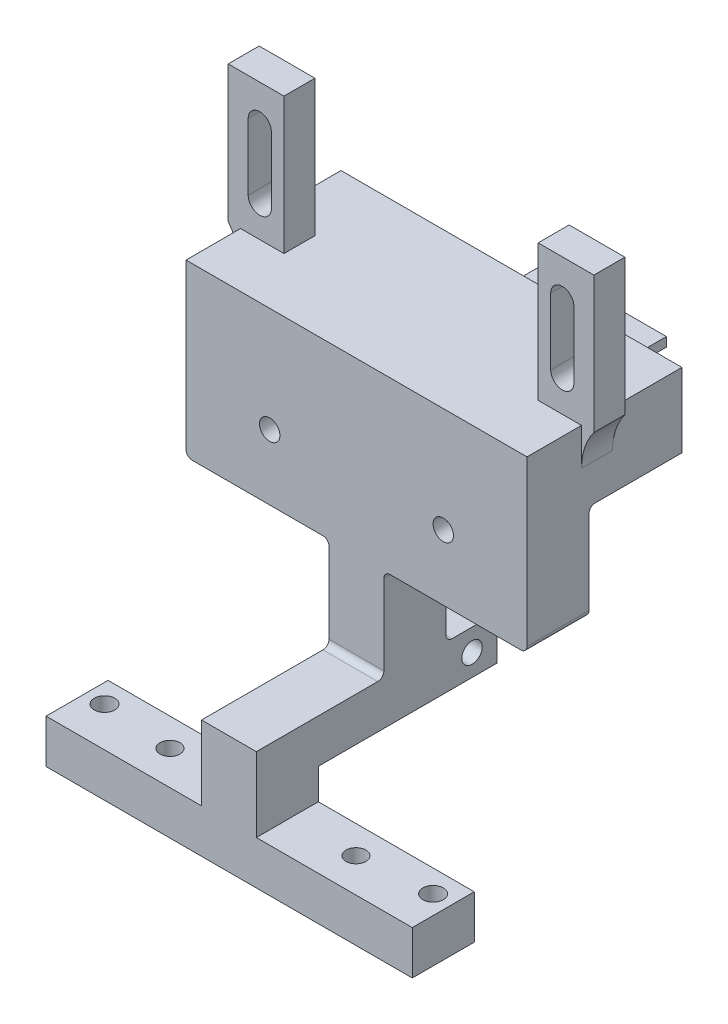
from build123d import *

# Parameters (mm, degrees)
SKETCH_1_W                   = 35
SKETCH_1_H                   = 40
EXTRUDE_1_DEPTH              = 5
SKETCH_2_W                   = 20
SKETCH_2_H                   = 20
EXTRUDE_2_DEPTH              = 65
SKETCH_3_W                   = 56
SKETCH_3_H                   = 11
SKETCH_3_W_2                 = 4.5
CUT_EXTRUDE_1_DEPTH          = 78.821912081
SKETCH_5_W                   = 55
SKETCH_5_H                   = 20
EXTRUDE_3_DEPTH              = 25
SKETCH_9_R                   = 1.65
CUT_EXTRUDE_3_DEPTH          = 27
SKETCH_10_W                  = 55
SKETCH_10_H                  = 25
EXTRUDE_4_DEPTH              = 4.9
SKETCH_11_W                  = 7
SKETCH_11_H                  = 5
EXTRUDE_5_DEPTH              = 21
CHAMFER_2_SIZE               = 10
CHAMFER_3_SIZE               = 3
CHAMFER_4_SIZE               = 2
CUT_EXTRUDE_7_DEPTH          = 15
SKETCH_16_W                  = 12.984556049
SKETCH_16_H                  = 11
EXTRUDE_6_DEPTH              = 20
CHAMFER_5_SIZE               = 3
SKETCH_19_R                  = 1.6
CUT_EXTRUDE_10_DEPTH         = 10
FILLET_1_R                   = 5
SKETCH_20_W                  = 5
SKETCH_20_H                  = 22.5
EXTRUDE_7_DEPTH              = 17.5
SKETCH_21_W                  = 5
SKETCH_21_H                  = 22.5
EXTRUDE_8_DEPTH              = 5
SKETCH_22_W                  = 5
SKETCH_22_H                  = 22.5
EXTRUDE_9_DEPTH              = 10
SKETCH_23_W                  = 5
SKETCH_23_H                  = 22.5
EXTRUDE_10_DEPTH             = 10
SKETCH_24_W                  = 3.3
SKETCH_24_H                  = 22.5
EXTRUDE_11_DEPTH             = 4
SKETCH_26_W                  = 5
SKETCH_26_H                  = 22.5
EXTRUDE_13_DEPTH             = 17.5
SKETCH_27_W                  = 5
SKETCH_27_H                  = 22.5
EXTRUDE_14_DEPTH             = 5
SKETCH_28_W                  = 5
SKETCH_28_H                  = 22.5
EXTRUDE_15_DEPTH             = 10
SKETCH_29_W                  = 5
SKETCH_29_H                  = 22.5
EXTRUDE_16_DEPTH             = 10
SKETCH_31_W                  = 3.4
SKETCH_31_H                  = 22.5
EXTRUDE_18_DEPTH             = 4
SKETCH_39_W                  = 7.13678645
SKETCH_39_H                  = 13.518332953
SKETCH_39_W_2                = 8.139264071
SKETCH_39_H_2                = 10.52230198
CUT_EXTRUDE_17_DEPTH         = 35
SKETCH_40_W                  = 55
SKETCH_40_H                  = 10
EXTRUDE_20_DEPTH             = 25.575713879
SKETCH_41_W                  = 8.84873954
SKETCH_41_H                  = 7.046133319
EXTRUDE_21_DEPTH             = 20.577981656
EXTRUDE_22_DEPTH             = 13.07563
EXTRUDE_22_DEPTH_BACK        = 22
SKETCH_42_W                  = 38.79276714
SKETCH_42_H                  = 7.046133319
SKETCH_43_W                  = 23.07563023
SKETCH_43_H                  = 28.79276714
CUT_EXTRUDE_18_DEPTH         = 22
FILLET_3_R                   = 1
SKETCH_46_W                  = 9.238205764
SKETCH_46_H                  = 22.5
EXTRUDE_26_DEPTH             = 10
CUT_EXTRUDE_19_DEPTH         = 10
SKETCH_48_R                  = 1.6
CUT_EXTRUDE_20_DEPTH         = 10
CUT_EXTRUDE_21_DEPTH         = 10
SKETCH_50_W                  = 2.57104036
SKETCH_50_H                  = 22.5
SKETCH_50_W_2                = 2.865096637
EXTRUDE_27_DEPTH             = 10
SKETCH_53_W                  = 4.304606657
SKETCH_53_H                  = 10
SKETCH_53_W_2                = 2.865096637
EXTRUDE_28_DEPTH             = 11
SKETCH_51_R                  = 1.6
CUT_EXTRUDE_22_DEPTH         = 12
SKETCH_52_W                  = 17.2
SKETCH_52_H                  = 6.8
CUT_EXTRUDE_23_DEPTH         = 39
CUT_EXTRUDE_24_DEPTH         = 10
SKETCH_55_W                  = 32
SKETCH_55_H                  = 22.5
EXTRUDE_29_DEPTH             = 12
SKETCH_56_W                  = 10.301119562
SKETCH_56_H                  = 22.5
CUT_EXTRUDE_25_DEPTH         = 7
SKETCH_57_W                  = 3
SKETCH_57_H                  = 4.95
EXTRUDE_30_DEPTH             = 8
SKETCH_58_W                  = 9
SKETCH_58_H                  = 22.5
SKETCH_58_W_2                = 8.434386946
CUT_EXTRUDE_26_DEPTH         = 10.05
CUT_EXTRUDE_27_DEPTH         = 1
SKETCH_60_W                  = 2.55
SKETCH_60_H                  = 22.5
EXTRUDE_31_DEPTH             = 12
SKETCH_61_W                  = 3.965384327
SKETCH_61_H                  = 22.5
CUT_EXTRUDE_28_DEPTH         = 6.95
SKETCH_62_W                  = 5
SKETCH_62_H                  = 22
EXTRUDE_32_DEPTH             = 2
SKETCH_63_W                  = 5
SKETCH_63_H                  = 22
EXTRUDE_33_DEPTH             = 2
SKETCH_64_W                  = 5
SKETCH_64_H                  = 22.5
EXTRUDE_34_DEPTH             = 8
SKETCH_65_W                  = 0.1
SKETCH_65_H                  = 22.5
CUT_EXTRUDE_30_DEPTH         = 15
SKETCH_66_W                  = 5
SKETCH_66_H                  = 22.5
EXTRUDE_35_DEPTH             = 8
SKETCH_67_R                  = 1.1
CUT_EXTRUDE_31_DEPTH         = 9
SKETCH_68_W                  = 0.1
SKETCH_68_H                  = 22.5
CUT_EXTRUDE_32_DEPTH         = 12
SKETCH_69_W                  = 12
SKETCH_69_H                  = 22.5
EXTRUDE_36_DEPTH             = 5
SKETCH_70_W                  = 107.728068616
SKETCH_70_H                  = 75.066227262
CUT_EXTRUDE_33_DEPTH         = 130
SKETCH_73_W                  = 6.7
SKETCH_73_H                  = 9
CUT_EXTRUDE_34_DEPTH         = 19
FILLET_5_R                   = 10
SKETCH_75_W                  = 20
SKETCH_75_H                  = 11.957252994
SKETCH_75_W_2                = 6.7
SKETCH_75_H_2                = 9
EXTRUDE_38_DEPTH             = 15
CUT_EXTRUDE_35_DEPTH         = 20
SKETCH_76_W                  = 3.65
SKETCH_76_H                  = 9
CUT_EXTRUDE_36_DEPTH         = 25
FILLET_6_R                   = 10
CHAMFER_6_SIZE               = 5
SKETCH_79_W                  = 10
SKETCH_79_H                  = 7.046133319
EXTRUDE_39_DEPTH             = 12
SKETCH_80_W                  = 10
SKETCH_80_H                  = 7.046133319
EXTRUDE_40_DEPTH             = 12
SKETCH_81_W                  = 8.84873954
SKETCH_81_H                  = 7.046133319
EXTRUDE_41_DEPTH             = 10
EXTRUDE_42_REACH             = 127.69
SKETCH_82_W                  = 10
SKETCH_82_H                  = 7.046133319
EXTRUDE_42_DIRECTION_2_REACH = 127.69
SKETCH_83_R                  = 1.65
CUT_EXTRUDE_37_DEPTH         = 8
SKETCH_84_W                  = 3
SKETCH_84_H                  = 7.046133319
EXTRUDE_43_DEPTH             = 8
EXTRUDE_43_2_DEPTH           = 8
SKETCH_85_R                  = 1.65
CUT_EXTRUDE_38_DEPTH         = 127.532560737
SPLIT_START                  = 66.785214516
SPLIT_BODIES_1_OUTLINE_W     = 59.07563023
SPLIT_BODIES_1_OUTLINE_H     = 7.046133319
SPLIT_BODIES_1_DEPTH         = 10
SPLIT_START_2                = -35.575713879
SPLIT_BODIES_1_2_OUTLINE_W   = 59.07563023
SPLIT_BODIES_1_2_OUTLINE_H   = 10
SPLIT_BODIES_1_2_OUTLINE_R   = 1.65
SPLIT_BODIES_1_2_DEPTH       = 7.046133319
SKETCH_87_R                  = 1.65
SKETCH_87_R_2                = 1.6
EXTRUDE_44_DEPTH             = 12
SKETCH_88_W                  = 25.07563023
SKETCH_88_H                  = 10
SKETCH_88_R                  = 1.65
SKETCH_88_R_2                = 1.6
SKETCH_88_W_2                = 25.15126046
CUT_EXTRUDE_40_DEPTH         = 12


# Read off the part's stored shape, not the designer's step: 分割1
with BuildPart() as part:
    # 草图1 → 凸台-拉伸1 (new body)
    with BuildSketch(Plane.XY):
        Rectangle(SKETCH_1_W, SKETCH_1_H)
    extrude(amount=EXTRUDE_1_DEPTH)

    # 草图2 → 凸台-拉伸2 (add)
    with BuildSketch(Plane.XY.offset(5)):
        Rectangle(SKETCH_2_W, SKETCH_2_H)
    extrude(amount=EXTRUDE_2_DEPTH)

    # 草图3 → 切除-拉伸1 (cut, through all)
    with BuildSketch(Plane.ZY.offset(10)):
        with Locations((37.5, 0)):
            Rectangle(SKETCH_3_W, SKETCH_3_H)
        with Locations((7.25, 0)):
            Rectangle(SKETCH_3_W_2, SKETCH_3_H)
    extrude(amount=-CUT_EXTRUDE_1_DEPTH, mode=Mode.SUBTRACT)

    # 草图5 → 凸台-拉伸3 (add)
    with BuildSketch(Plane.XY.offset(70)):
        Rectangle(SKETCH_5_W, SKETCH_5_H)
    extrude(amount=EXTRUDE_3_DEPTH)

    # 草图9 → 切除-拉伸3 (cut)
    with BuildSketch(Plane.XY.offset(95)):
        with Locations((-14, -3.042747006)):
            Circle(SKETCH_9_R)
        with Locations((14, -3.042747006)):
            Circle(SKETCH_9_R)
    extrude(amount=-CUT_EXTRUDE_3_DEPTH, mode=Mode.SUBTRACT)

    # 草图10 → 凸台-拉伸4 (add)
    with BuildSketch(Plane(origin=(0, 10, 0), x_dir=(1, 0, 0), z_dir=(0, 1, 0))):
        with Locations((0, -82.5)):
            Rectangle(SKETCH_10_W, SKETCH_10_H)
    extrude(amount=EXTRUDE_4_DEPTH)

    # 草图11 → 凸台-拉伸5 (add)
    with BuildSketch(Plane(origin=(0, 14.9, 0), x_dir=(1, 0, 0), z_dir=(0, 1, 0))):
        with Locations((-24, -83.7)):
            Rectangle(SKETCH_11_W, SKETCH_11_H)
        with Locations((24, -83.7)):
            Rectangle(SKETCH_11_W, SKETCH_11_H)
    extrude(amount=EXTRUDE_5_DEPTH)

    # 倒角2
    chamfer_2_edges = [part.edges().sort_by_distance(p)[0] for p in [
        (0, -5.5, 65.5),
    ]]
    chamfer(chamfer_2_edges, length=CHAMFER_2_SIZE)

    # 倒角3
    chamfer_3_edges = [part.edges().sort_by_distance(p)[0] for p in [
        (0, 10, 70),
    ]]
    chamfer(chamfer_3_edges, length=CHAMFER_3_SIZE)

    # 倒角4
    chamfer_4_edges = [part.edges().sort_by_distance(p)[0] for p in [
        (0, -10, 5),
    ]]
    chamfer(chamfer_4_edges, length=CHAMFER_4_SIZE)

    # 草图15 → 切除-拉伸7 (cut)
    with BuildSketch(Plane(origin=(0, 0, 70), x_dir=(-1, 0, 0), z_dir=(0, 0, -1))):
        Polygon((10, 1.957252994), (29.13083687, 1.957252994), (29.13083687, -8.042747006), (29.13083687, -10), (10, -10), (10, -8.042747006), align=None)
        Polygon((-29.13083687, 1.957252994), (-29.13083687, -8.042747006), (-29.13083687, -10), (-10, -10), (-10, -8.042747006), (-10, 1.957252994), align=None)
    extrude(amount=-CUT_EXTRUDE_7_DEPTH, mode=Mode.SUBTRACT)

    # 草图16 → 凸台-拉伸6 (add)
    with BuildSketch(Plane.ZY.offset(10)):
        with Locations((11.492278025, 0)):
            Rectangle(SKETCH_16_W, SKETCH_16_H)
    extrude(amount=-EXTRUDE_6_DEPTH)

    # 倒角5
    chamfer_5_edges = [part.edges().sort_by_distance(p)[0] for p in [
        (0, 5.5, 17.984556049),
    ]]
    chamfer(chamfer_5_edges, length=CHAMFER_5_SIZE)

    # 草图19 → 切除-拉伸10 (cut)
    with BuildSketch(Plane.XY.offset(86.2)):
        with Locations((-24.4, 29.9)):
            Circle(SKETCH_19_R)
        with Locations((-24.4, 19.9)):
            Circle(SKETCH_19_R)
        with Locations((24.4, 19.9)):
            Circle(SKETCH_19_R)
        with Locations((24.4, 29.9)):
            Circle(SKETCH_19_R)
    extrude(amount=-CUT_EXTRUDE_10_DEPTH, mode=Mode.SUBTRACT)

    # 圆角1
    fillet_1_edges = [part.edges().sort_by_distance(p)[0] for p in [
        (17.5, -20, 2.5),
        (-17.5, -20, 2.5),
        (-17.5, 20, 2.5),
        (17.5, 20, 2.5),
    ]]
    fillet(fillet_1_edges, radius=FILLET_1_R)

    # 草图20 → 凸台-拉伸7 (add)
    with BuildSketch(Plane.ZY.offset(17.5)):
        with Locations((2.5, 0)):
            Rectangle(SKETCH_20_W, SKETCH_20_H)
    extrude(amount=EXTRUDE_7_DEPTH)

    # 草图21 → 凸台-拉伸8 (add)
    with BuildSketch(Plane.ZY.offset(35)):
        with Locations((2.5, 0)):
            Rectangle(SKETCH_21_W, SKETCH_21_H)
    extrude(amount=EXTRUDE_8_DEPTH)

    # 草图22 → 凸台-拉伸9 (add)
    with BuildSketch(Plane(origin=(0, 0, 0), x_dir=(-1, 0, 0), z_dir=(0, 0, -1))):
        with Locations((37.5, 0)):
            Rectangle(SKETCH_22_W, SKETCH_22_H)
    extrude(amount=EXTRUDE_9_DEPTH)

    # 草图23 → 凸台-拉伸10 (add)
    with BuildSketch(Plane(origin=(0, 0, 0), x_dir=(-1, 0, 0), z_dir=(0, 0, -1))):
        with Locations((15.5, 0)):
            Rectangle(SKETCH_23_W, SKETCH_23_H)
    extrude(amount=EXTRUDE_10_DEPTH)

    # 草图24 → 凸台-拉伸11 (add)
    with BuildSketch(Plane.ZY.offset(18)):
        with Locations((-8.35, 0)):
            Rectangle(SKETCH_24_W, SKETCH_24_H)
    extrude(amount=EXTRUDE_11_DEPTH)

    # 草图26 → 凸台-拉伸13 (add)
    with BuildSketch(Plane(origin=(17.5, 0, 0), x_dir=(0, 0, -1), z_dir=(1, 0, 0))):
        with Locations((-2.5, 0)):
            Rectangle(SKETCH_26_W, SKETCH_26_H)
    extrude(amount=EXTRUDE_13_DEPTH)

    # 草图27 → 凸台-拉伸14 (add)
    with BuildSketch(Plane(origin=(35, 0, 0), x_dir=(0, 0, -1), z_dir=(1, 0, 0))):
        with Locations((-2.5, 0)):
            Rectangle(SKETCH_27_W, SKETCH_27_H)
    extrude(amount=EXTRUDE_14_DEPTH)

    # 草图28 → 凸台-拉伸15 (add)
    with BuildSketch(Plane(origin=(0, 0, 0), x_dir=(-1, 0, 0), z_dir=(0, 0, -1))):
        with Locations((-37.5, 0)):
            Rectangle(SKETCH_28_W, SKETCH_28_H)
    extrude(amount=EXTRUDE_15_DEPTH)

    # 草图29 → 凸台-拉伸16 (add)
    with BuildSketch(Plane(origin=(0, 0, 0), x_dir=(-1, 0, 0), z_dir=(0, 0, -1))):
        with Locations((-15.5, 0)):
            Rectangle(SKETCH_29_W, SKETCH_29_H)
    extrude(amount=EXTRUDE_16_DEPTH)

    # 草图31 → 凸台-拉伸18 (add)
    with BuildSketch(Plane(origin=(18, 0, 0), x_dir=(0, 0, -1), z_dir=(1, 0, 0))):
        with Locations((8.3, 0)):
            Rectangle(SKETCH_31_W, SKETCH_31_H)
    extrude(amount=EXTRUDE_18_DEPTH)

    # 草图39 → 切除-拉伸17 (cut)
    with BuildSketch(Plane.ZY.offset(17.5)):
        with Locations((3.568393225, 18.009166476)):
            Rectangle(SKETCH_39_W, SKETCH_39_H)
        with Locations((4.069632036, -16.51115099)):
            Rectangle(SKETCH_39_W_2, SKETCH_39_H_2)
    extrude(amount=-CUT_EXTRUDE_17_DEPTH, mode=Mode.SUBTRACT)

    # 草图40 → 凸台-拉伸20 (add)
    with BuildSketch(Plane.XZ.offset(10)):
        with Locations((0, 90)):
            Rectangle(SKETCH_40_W, SKETCH_40_H)
    extrude(amount=EXTRUDE_20_DEPTH)

    # 草图41 → 凸台-拉伸21 (add)
    with BuildSketch(Plane.XY.offset(95)):
        with Locations((0, -32.05264722)):
            Rectangle(SKETCH_41_W, SKETCH_41_H)
    extrude(amount=EXTRUDE_21_DEPTH)

    # 草图42 → 凸台-拉伸22 (add, two sides: drawn at the far end of the back side and taken through both)
    with BuildSketch(Plane.ZY.offset(4.42436977).offset(-EXTRUDE_22_DEPTH_BACK)):
        with Locations((96.181598086, -32.05264722)):
            Rectangle(SKETCH_42_W, SKETCH_42_H)
    extrude(amount=EXTRUDE_22_DEPTH + EXTRUDE_22_DEPTH_BACK)

    # 草图43 → 切除-拉伸18 (cut)
    with BuildSketch(Plane.XZ.offset(35.575713879)):
        with Locations((15.962184885, 91.181598086)):
            Rectangle(SKETCH_43_W, SKETCH_43_H)
        with Locations((-15.962184885, 91.181598086)):
            Rectangle(SKETCH_43_W, SKETCH_43_H)
    extrude(amount=-CUT_EXTRUDE_18_DEPTH, mode=Mode.SUBTRACT)

    # 圆角3
    fillet_3_edges = [part.edges().sort_by_distance(p)[0] for p in [
        (-18.75, 1.957252994, 85),
        (18.75, 1.957252994, 85),
        (0, -10, 85),
        (0, -28.52958056, 85),
        (0, -28.52958056, 95),
        (27.5, -13.575713879, 90),
        (4.42436977, -13.575713879, 90),
        (-27.5, -13.575713879, 90),
        (-4.42436977, -13.575713879, 90),
    ]]
    fillet(fillet_3_edges, radius=FILLET_3_R)

    # 草图46 → 凸台-拉伸26 (add)
    with BuildSketch(Plane(origin=(0, 0, 0), x_dir=(-1, 0, 0), z_dir=(0, 0, -1))):
        with Locations((-8.380897118, 0)):
            Rectangle(SKETCH_46_W, SKETCH_46_H)
    extrude(amount=EXTRUDE_26_DEPTH)

    # 草图47 → 切除-拉伸19 (cut)
    with BuildSketch(Plane(origin=(0, 0, -10), x_dir=(-1, 0, 0), z_dir=(0, 0, -1))):
        with BuildLine():
            Line((-8.066400893, 11.25), (-10.700516417, 11.25))
            Line((-10.700516417, 11.25), (-10.700516417, -11.25))
            Line((-10.700516417, -11.25), (-6.332834596, -11.25))
            ThreePointArc((-6.332834596, -11.25), (-6.663682414, -9.62836823), (-8.066400893, -8.75))
            Line((-8.066400893, -8.75), (-8.066400893, -7.900028072))
            ThreePointArc((-8.066400893, -7.900028072), (-6.289381928, -5.825014036), (-8.066400893, -3.75))
            Line((-8.066400893, -3.75), (-8.066400893, -2.900028072))
            ThreePointArc((-8.066400893, -2.900028072), (-6.289381928, -0.825014036), (-8.066400893, 1.25))
            Line((-8.066400893, 1.25), (-8.066400893, 2.099971928))
            ThreePointArc((-8.066400893, 2.099971928), (-6.289381928, 4.174985964), (-8.066400893, 6.25))
            Line((-8.066400893, 6.25), (-8.066400893, 7.099971928))
            ThreePointArc((-8.066400893, 7.099971928), (-6.289381928, 9.174985964), (-8.066400893, 11.25))
        make_face()
    extrude(amount=-CUT_EXTRUDE_19_DEPTH, mode=Mode.SUBTRACT)

    # 草图48 → 切除-拉伸20 (cut)
    with BuildSketch(Plane(origin=(0, -28.52958056, 0), x_dir=(1, 0, 0), z_dir=(0, 1, 0))):
        with Locations(Location((15, -110.089556655, 0), (0, 0, 270))):
            Circle(SKETCH_48_R)
        with Locations(Location((-15, -110.089556655, 0), (0, 0, 270))):
            Circle(SKETCH_48_R)
    extrude(amount=-CUT_EXTRUDE_20_DEPTH, mode=Mode.SUBTRACT)

    # 草图49 → 切除-拉伸21 (cut)
    with BuildSketch(Plane.XY.offset(86.2)):
        with BuildLine():
            Line((-22.528691915, 29.9), (-22.528691915, 19.165676086))
            ThreePointArc((-22.528691915, 19.165676086), (-24.4, 17.294368), (-26.271308085, 19.165676086))
            Line((-26.271308085, 19.165676086), (-26.271308085, 29.9))
            ThreePointArc((-26.271308085, 29.9), (-24.4, 31.771308085), (-22.528691915, 29.9))
        make_face()
        with BuildLine():
            Line((22.528691915, 29.9), (22.528691915, 19.165676086))
            ThreePointArc((22.528691915, 19.165676086), (24.4, 17.294368), (26.271308085, 19.165676086))
            Line((26.271308085, 19.165676086), (26.271308085, 29.9))
            ThreePointArc((26.271308085, 29.9), (24.4, 31.771308085), (22.528691915, 29.9))
        make_face()
    extrude(amount=-CUT_EXTRUDE_21_DEPTH, mode=Mode.SUBTRACT)

    # 草图50 → 凸台-拉伸27 (add)
    with BuildSketch(Plane(origin=(0, 0, -10), x_dir=(-1, 0, 0), z_dir=(0, 0, -1))):
        with Locations((-5.047314416, 0)):
            Rectangle(SKETCH_50_W, SKETCH_50_H)
        with Locations((-12.133064736, 0)):
            Rectangle(SKETCH_50_W_2, SKETCH_50_H)
    extrude(amount=EXTRUDE_27_DEPTH)

    # 草图53 → 凸台-拉伸28 (add)
    with BuildSketch(Plane(origin=(0, 11.25, 0), x_dir=(1, 0, 0), z_dir=(0, 1, 0))):
        with Locations((5.914097565, 5)):
            Rectangle(SKETCH_53_W, SKETCH_53_H)
        with Locations((12.133064736, 5)):
            Rectangle(SKETCH_53_W_2, SKETCH_53_H)
    extrude(amount=EXTRUDE_28_DEPTH)

    # 草图51 → 切除-拉伸22 (cut)
    with BuildSketch(Plane(origin=(13.565613054, 0, 0), x_dir=(0, 0, -1), z_dir=(1, 0, 0))):
        with Locations((16, 6.25)):
            Circle(SKETCH_51_R)
        with Locations((16, -6.25)):
            Circle(SKETCH_51_R)
    extrude(amount=-CUT_EXTRUDE_22_DEPTH, mode=Mode.SUBTRACT)

    # 草图52 → 切除-拉伸23 (cut)
    with BuildSketch(Plane(origin=(0, 11.25, 0), x_dir=(1, 0, 0), z_dir=(0, 1, 0))):
        with Locations((-26.5, 3.35)):
            Rectangle(SKETCH_52_W, SKETCH_52_H)
        with Locations((26.5, 3.35)):
            Rectangle(SKETCH_52_W, SKETCH_52_H)
    extrude(amount=-CUT_EXTRUDE_23_DEPTH, mode=Mode.SUBTRACT)

    # 草图54 → 切除-拉伸24 (cut)
    with BuildSketch(Plane(origin=(0, 0, -10), x_dir=(-1, 0, 0), z_dir=(0, 0, -1))):
        with BuildLine():
            ThreePointArc((-8.066400893, 12.099971928), (-6.289381928, 14.174985964), (-8.066400893, 16.25))
            Line((-8.066400893, 16.25), (-8.066400893, 12.099971928))
        make_face()
        with BuildLine():
            ThreePointArc((-8.066400893, 17.099971928), (-6.289381928, 19.174985964), (-8.066400893, 21.25))
            Line((-8.066400893, 21.25), (-8.066400893, 17.099971928))
        make_face()
    extrude(amount=-CUT_EXTRUDE_24_DEPTH, mode=Mode.SUBTRACT)

    # 草图55 → 凸台-拉伸29 (add)
    with BuildSketch(Plane.XY.offset(5)):
        Rectangle(SKETCH_55_W, SKETCH_55_H)
    extrude(amount=EXTRUDE_29_DEPTH)

    # 草图56 → 切除-拉伸25 (cut)
    with BuildSketch(Plane(origin=(0, 0, 0), x_dir=(-1, 0, 0), z_dir=(0, 0, -1))):
        with Locations((7.849440219, 0)):
            Rectangle(SKETCH_56_W, SKETCH_56_H)
    extrude(amount=-CUT_EXTRUDE_25_DEPTH, mode=Mode.SUBTRACT)

    # 草图57 → 凸台-拉伸30 (add)
    with BuildSketch(Plane(origin=(0, 11.25, 0), x_dir=(1, 0, 0), z_dir=(0, 1, 0))):
        with Locations((-18.465384327, -2.525)):
            Rectangle(SKETCH_57_W, SKETCH_57_H)
        with Locations((-34.665384327, -2.525)):
            Rectangle(SKETCH_57_W, SKETCH_57_H)
    extrude(amount=EXTRUDE_30_DEPTH)

    # 草图58 → 切除-拉伸26 (cut)
    with BuildSketch(Plane(origin=(0, 0, -10), x_dir=(-1, 0, 0), z_dir=(0, 0, -1))):
        with Locations((17.5, 0)):
            Rectangle(SKETCH_58_W, SKETCH_58_H)
        with Locations((-17.782806527, 0)):
            Rectangle(SKETCH_58_W_2, SKETCH_58_H)
    extrude(amount=-CUT_EXTRUDE_26_DEPTH, mode=Mode.SUBTRACT)

    # 草图59 → 切除-拉伸27 (cut)
    with BuildSketch(Plane(origin=(0, 14.9, 0), x_dir=(1, 0, 0), z_dir=(0, 1, 0))):
        Polygon((20.5, -86.2), (20.5, -81.2), (27.5, -81.2), (27.5, -70), (-27.5, -70), (-27.5, -81.2), (-20.5, -81.2), (-20.5, -86.2), (-27.5, -86.2), (-27.5, -95), (27.5, -95), (27.5, -86.2), align=None)
    extrude(amount=-CUT_EXTRUDE_27_DEPTH, mode=Mode.SUBTRACT)

    # 草图60 → 凸台-拉伸31 (add)
    with BuildSketch(Plane.XY.offset(5)):
        with Locations((-17.275, 0)):
            Rectangle(SKETCH_60_W, SKETCH_60_H)
        with Locations((17.275, 0)):
            Rectangle(SKETCH_60_W, SKETCH_60_H)
    extrude(amount=EXTRUDE_31_DEPTH)

    # 草图61 → 切除-拉伸28 (cut)
    with BuildSketch(Plane(origin=(0, 0, 0.05), x_dir=(-1, 0, 0), z_dir=(0, 0, -1))):
        with Locations((14.982692164, 0)):
            Rectangle(SKETCH_61_W, SKETCH_61_H)
    extrude(amount=-CUT_EXTRUDE_28_DEPTH, mode=Mode.SUBTRACT)

    # 草图62 → 凸台-拉伸32 (add)
    with BuildSketch(Plane.ZY.offset(27.5)):
        with Locations((83.7, 24.9)):
            Rectangle(SKETCH_62_W, SKETCH_62_H)
    extrude(amount=EXTRUDE_32_DEPTH)

    # 草图63 → 凸台-拉伸33 (add)
    with BuildSketch(Plane(origin=(27.5, 0, 0), x_dir=(0, 0, -1), z_dir=(1, 0, 0))):
        with Locations((-83.7, 24.9)):
            Rectangle(SKETCH_63_W, SKETCH_63_H)
    extrude(amount=EXTRUDE_33_DEPTH)

    # 草图64 → 凸台-拉伸34 (add)
    with BuildSketch(Plane(origin=(0, 0, -10), x_dir=(-1, 0, 0), z_dir=(0, 0, -1))):
        with Locations((-37.5, 0)):
            Rectangle(SKETCH_64_W, SKETCH_64_H)
    extrude(amount=EXTRUDE_34_DEPTH)

    # 草图65 → 切除-拉伸30 (cut)
    with BuildSketch(Plane(origin=(0, 0, -18), x_dir=(-1, 0, 0), z_dir=(0, 0, -1))):
        with Locations((-35.05, 0)):
            Rectangle(SKETCH_65_W, SKETCH_65_H)
    extrude(amount=-CUT_EXTRUDE_30_DEPTH, mode=Mode.SUBTRACT)

    # 草图66 → 凸台-拉伸35 (add)
    with BuildSketch(Plane(origin=(0, 0, -10), x_dir=(-1, 0, 0), z_dir=(0, 0, -1))):
        with Locations((37.5, 0)):
            Rectangle(SKETCH_66_W, SKETCH_66_H)
    extrude(amount=EXTRUDE_35_DEPTH)

    # 草图67 → 切除-拉伸31 (cut)
    with BuildSketch(Plane(origin=(40, 0, 0), x_dir=(0, 0, -1), z_dir=(1, 0, 0))):
        with Locations(Location((2.45, 4.25, 0), (0, 0, 90))):
            Circle(SKETCH_67_R)
        with Locations(Location((2.45, -3.75, 0), (0, 0, 90))):
            Circle(SKETCH_67_R)
        with Locations(Location((14.45, -3.75, 0), (0, 0, 90))):
            Circle(SKETCH_67_R)
        with Locations(Location((14.45, 4.25, 0), (0, 0, 90))):
            Circle(SKETCH_67_R)
    cut_extrude_31 = extrude(amount=-CUT_EXTRUDE_31_DEPTH, mode=Mode.SUBTRACT)

    # 镜向1: 切除-拉伸31 across plane
    add(cut_extrude_31.mirror(Plane(origin=(0, 0, 0), x_dir=(0, 0, 1), z_dir=(1, 0, 0))), mode=Mode.SUBTRACT)

    # 草图68 → 切除-拉伸32 (cut)
    with BuildSketch(Plane(origin=(0, 0, -18), x_dir=(-1, 0, 0), z_dir=(0, 0, -1))):
        with Locations((35.05, 0)):
            Rectangle(SKETCH_68_W, SKETCH_68_H)
    extrude(amount=-CUT_EXTRUDE_32_DEPTH, mode=Mode.SUBTRACT)

    # 草图69 → 凸台-拉伸36 (add)
    with BuildSketch(Plane.ZY.offset(18.55)):
        with Locations((11, 0)):
            Rectangle(SKETCH_69_W, SKETCH_69_H)
    extrude(amount=EXTRUDE_36_DEPTH)

    # 草图70 → 切除-拉伸33 (cut)
    with BuildSketch(Plane(origin=(0, 0, 70), x_dir=(-1, 0, 0), z_dir=(0, 0, -1))):
        Rectangle(SKETCH_70_W, SKETCH_70_H)
    extrude(amount=CUT_EXTRUDE_33_DEPTH, mode=Mode.SUBTRACT)

    # 草图73 → 切除-拉伸34 (cut)
    with BuildSketch(Plane(origin=(0, 0, 70), x_dir=(-1, 0, 0), z_dir=(0, 0, -1))):
        with Locations((0, -4.021373503)):
            Rectangle(SKETCH_73_W, SKETCH_73_H)
    extrude(amount=-CUT_EXTRUDE_34_DEPTH, mode=Mode.SUBTRACT)

    # 圆角5
    # the kernel refuses this fillet: 10 mm, written as the material it adds along each edge
    with BuildSketch(Plane(origin=(-27.5, 13.9, 86.2), x_dir=(0, -1, 0), z_dir=(0, 0, -1)), Plane(origin=(27.5, 13.9, 81.2), x_dir=(0, -1, 0), z_dir=(0, 0, 1))) as fillet_5_piece_1:
        with BuildLine():
            CenterArc((6, 10), FILLET_5_R, 233.130102354, 36.869897646)
            Line((0, 2), (0, 0))
            Line((0, 0), (6, 0))
        make_face()
    extrude(amount=5)

    # 草图75 → 凸台-拉伸38 (add)
    with BuildSketch(Plane(origin=(0, 0, 70), x_dir=(-1, 0, 0), z_dir=(0, 0, -1))):
        with Locations((0, -4.021373503)):
            Rectangle(SKETCH_75_W, SKETCH_75_H)
        with Locations((0, -4.021373503)):
            Rectangle(SKETCH_75_W_2, SKETCH_75_H_2, mode=Mode.SUBTRACT)
    extrude(amount=EXTRUDE_38_DEPTH)

    # 草图74 → 切除-拉伸35 (cut)
    with BuildSketch(Plane(origin=(10, 0, 0), x_dir=(0, 0, -1), z_dir=(1, 0, 0))):
        with BuildLine():
            Line((-82.596309624, -2.421373503), (-58.15800679, -2.421373503))
            ThreePointArc((-58.15800679, -2.421373503), (-56.55800679, -4.021373503), (-58.15800679, -5.621373503))
            Line((-58.15800679, -5.621373503), (-82.596309624, -5.621373503))
            ThreePointArc((-82.596309624, -5.621373503), (-84.196309624, -4.021373503), (-82.596309624, -2.421373503))
        make_face()
    extrude(amount=-CUT_EXTRUDE_35_DEPTH, mode=Mode.SUBTRACT)

    # 草图76 → 切除-拉伸36 (cut)
    with BuildSketch(Plane(origin=(0, 0, 55), x_dir=(-1, 0, 0), z_dir=(0, 0, -1))):
        with Locations((-8.175, -4.021373503)):
            Rectangle(SKETCH_76_W, SKETCH_76_H)
        with Locations((8.175, -4.021373503)):
            Rectangle(SKETCH_76_W, SKETCH_76_H)
    extrude(amount=-CUT_EXTRUDE_36_DEPTH, mode=Mode.SUBTRACT)

    # 圆角6
    # the kernel refuses this fillet: 10 mm, written as the material it adds along each edge
    with BuildSketch(Plane(origin=(-6.35, 0.478626497, 80), x_dir=(-1, 0, 0), z_dir=(0, -1, 0))) as fillet_6_piece_1:
        with BuildLine():
            CenterArc((10, 7.725121358), FILLET_6_R, 180, 50.580015533)
            Line((0, 7.725121358), (0, 0))
            Line((0, 0), (3.65, 0))
        make_face()
    extrude(amount=2.9)
    with BuildSketch(Plane(origin=(6.35, 0.478626497, 80), x_dir=(1, 0, 0), z_dir=(0, -1, 0))) as fillet_6_piece_2:
        with BuildLine():
            CenterArc((10, -7.725121358), FILLET_6_R, 129.419984467, 50.580015533)
            Line((0, -7.725121358), (0, 0))
            Line((0, 0), (3.65, 0))
        make_face()
    extrude(amount=2.9)

    # 倒角6
    chamfer_6_edges = [part.edges().sort_by_distance(p)[0] for p in [
        (0, 1.957252994, 70),
    ]]
    chamfer(chamfer_6_edges, length=CHAMFER_6_SIZE)

    # 草图79 → 凸台-拉伸39 (add)
    with BuildSketch(Plane(origin=(17.57563023, 0, 0), x_dir=(0, 0, -1), z_dir=(1, 0, 0))):
        with Locations((-110.577981656, -32.05264722)):
            Rectangle(SKETCH_79_W, SKETCH_79_H)
    extrude(amount=EXTRUDE_39_DEPTH)

    # 草图80 → 凸台-拉伸40 (add)
    with BuildSketch(Plane.ZY.offset(17.5)):
        with Locations((110.577981656, -32.05264722)):
            Rectangle(SKETCH_80_W, SKETCH_80_H)
    extrude(amount=EXTRUDE_40_DEPTH)

    # 草图81 → 凸台-拉伸41 (add)
    with BuildSketch(Plane(origin=(0, 0, 76.785214516), x_dir=(-1, 0, 0), z_dir=(0, 0, -1))):
        with Locations((0, -32.05264722)):
            Rectangle(SKETCH_81_W, SKETCH_81_H)
    extrude(amount=EXTRUDE_41_DEPTH)

    # 凸台-拉伸42: up to this face of the body (flat: up to its plane)
    extrude_42_end = Plane(part.part.faces().sort_by_distance((29.57563023, -32.052647219, 110.577981656))[0])
    # 草图82 → 凸台-拉伸42 (add, up to the picked face)
    with BuildSketch(Plane(origin=(4.42436977, 0, 0), x_dir=(0, 0, -1), z_dir=(1, 0, 0)), mode=Mode.PRIVATE) as extrude_42_sk1:
        with Locations((-71.785214516, -32.05264722)):
            Rectangle(SKETCH_82_W, SKETCH_82_H)
    extrude_42_tool1 = split(extrude(extrude_42_sk1.sketch, amount=EXTRUDE_42_REACH, mode=Mode.PRIVATE), bisect_by=extrude_42_end, keep=Keep.BOTH, mode=Mode.PRIVATE)
    add(extrude_42_tool1.solids().sort_by(Axis((4.42437, -32.052647, 71.785215), (1, 0, 0)))[0])

    # 凸台-拉伸42 direction 2: up to this face of the body (flat: up to its plane)
    extrude_42_direction_2_end = Plane(part.part.faces().sort_by_distance((-29.5, -32.052647219, 110.577981656))[0])
    # 草图82 → 凸台-拉伸42 direction 2 (add, up to the picked face)
    with BuildSketch(Plane(origin=(4.42436977, 0, 0), x_dir=(0, 0, -1), z_dir=(1, 0, 0)), mode=Mode.PRIVATE) as extrude_42_direction_2_sk1:
        with Locations((-71.785214516, -32.05264722)):
            Rectangle(SKETCH_82_W, SKETCH_82_H)
    extrude_42_direction_2_tool1 = split(extrude(extrude_42_direction_2_sk1.sketch, amount=-EXTRUDE_42_DIRECTION_2_REACH, mode=Mode.PRIVATE), bisect_by=extrude_42_direction_2_end, keep=Keep.BOTH, mode=Mode.PRIVATE)
    add(extrude_42_direction_2_tool1.solids().sort_by(Axis((4.42437, -32.052647, 71.785215), (-1, 0, 0)))[0])

    # 草图83 → 切除-拉伸37 (cut)
    with BuildSketch(Plane(origin=(0, -28.52958056, 0), x_dir=(1, 0, 0), z_dir=(0, 1, 0))):
        with Locations(Location((26.537815115, -73.181598086, 0), (0, 0, 180))):
            Circle(SKETCH_83_R)
        with Locations(Location((26.537815115, -109.181598086, 0), (0, 0, 180))):
            Circle(SKETCH_83_R)
        with Locations(Location((-26.462184885, -73.181598086, 0), (0, 0, 180))):
            Circle(SKETCH_83_R)
        with Locations(Location((-26.462184885, -109.181598086, 0), (0, 0, 180))):
            Circle(SKETCH_83_R)
    extrude(amount=-CUT_EXTRUDE_37_DEPTH, mode=Mode.SUBTRACT)


with BuildPart() as body_2:
    # 草图84 → 凸台-拉伸43 (new body)
    with BuildSketch(Plane.XY.offset(76.785214516)):
        with Locations((-5.92436977, -32.05264722)):
            Rectangle(SKETCH_84_W, SKETCH_84_H)
    extrude(amount=EXTRUDE_43_DEPTH)


with BuildPart() as body_3:
    # 草图84 → Extrude 43 2 (new body)
    with BuildSketch(Plane.XY.offset(76.785214516)):
        with Locations((5.92436977, -32.05264722)):
            Rectangle(SKETCH_84_W, SKETCH_84_H)
    extrude(amount=EXTRUDE_43_2_DEPTH)


with BuildPart() as cut_extrude_38_tool:
    # 草图85 → 切除-拉伸38 (new, through all)
    with BuildSketch(Plane(origin=(7.42436977, 0, 0), x_dir=(0, 0, -1), z_dir=(1, 0, 0))):
        with Locations(Location((-80.785214516, -32.075713879, 0), (0, 0, 90))):
            Circle(SKETCH_85_R)
    extrude(amount=-CUT_EXTRUDE_38_DEPTH)


with BuildPart() as part_1:
    add(part.part)

    # 切除-拉伸38: cut by cut_extrude_38_tool
    add(cut_extrude_38_tool.part, mode=Mode.SUBTRACT)

    # Split Bodies 1 outline → Split Bodies 1 (cut)
    with BuildSketch(Plane.XY.offset(SPLIT_START)):
        with Locations((0.037815115, -32.05264722)):
            Rectangle(SPLIT_BODIES_1_OUTLINE_W, SPLIT_BODIES_1_OUTLINE_H)
    extrude(amount=SPLIT_BODIES_1_DEPTH, mode=Mode.SUBTRACT)

    # 草图87 → 凸台-拉伸44 (add)
    with BuildSketch(Plane.XZ.offset(35.575713879)):
        Polygon((-4.42436977, 105.577981656), (4.42436977, 105.577981656), (29.57563023, 105.577981656), (29.57563023, 115.577981656), (-29.5, 115.577981656), (-29.5, 105.577981656), align=None)
        with Locations(Location((-26.462184885, 109.181598086, 0), (0, 0, 180))):
            Circle(SKETCH_87_R, mode=Mode.SUBTRACT)
        with Locations(Location((15, 110.089556655, 0), (0, 0, 90))):
            Circle(SKETCH_87_R_2, mode=Mode.SUBTRACT)
        with Locations(Location((-15, 110.089556655, 0), (0, 0, 90))):
            Circle(SKETCH_87_R_2, mode=Mode.SUBTRACT)
        with Locations(Location((26.537815115, 109.181598086, 0), (0, 0, 180))):
            Circle(SKETCH_87_R, mode=Mode.SUBTRACT)
    extrude(amount=EXTRUDE_44_DEPTH)

    # 草图88 → 切除-拉伸40 (cut)
    # profile 1 of 2: a face of its own
    with BuildSketch(Plane(origin=(0, -28.52958056, 0), x_dir=(1, 0, 0), z_dir=(0, 1, 0))):
        with Locations((-16.962184885, -110.577981656)):
            Rectangle(SKETCH_88_W, SKETCH_88_H)
        with Locations(Location((-26.462184885, -109.181598086, 0), (0, 0, 270))):
            Circle(SKETCH_88_R, mode=Mode.SUBTRACT)
        with Locations(Location((-15, -110.089556655, 0), (0, 0, 270))):
            Circle(SKETCH_88_R_2, mode=Mode.SUBTRACT)
    # profile 2 of 2: a face of its own
    with BuildSketch(Plane(origin=(0, -28.52958056, 0), x_dir=(1, 0, 0), z_dir=(0, 1, 0))):
        with Locations((17, -110.577981656)):
            Rectangle(SKETCH_88_W_2, SKETCH_88_H)
        with Locations(Location((15, -110.089556655, 0), (0, 0, 270))):
            Circle(SKETCH_88_R_2, mode=Mode.SUBTRACT)
        with Locations(Location((26.537815115, -109.181598086, 0), (0, 0, 270))):
            Circle(SKETCH_88_R, mode=Mode.SUBTRACT)
    extrude(amount=-CUT_EXTRUDE_40_DEPTH, mode=Mode.SUBTRACT)


with BuildPart() as body_2_1:
    add(body_2.part)

    # 切除-拉伸38: cut by cut_extrude_38_tool
    add(cut_extrude_38_tool.part, mode=Mode.SUBTRACT)


with BuildPart() as body_3_1:
    add(body_3.part)

    # 切除-拉伸38: cut by cut_extrude_38_tool
    add(cut_extrude_38_tool.part, mode=Mode.SUBTRACT)


with BuildPart() as body_2_2:
    # Split Bodies 1 2 outline → Split Bodies 1 2 (new body)
    with BuildSketch(Plane(origin=(0, 0, 0), x_dir=(1, 0, 0), z_dir=(0, 1, 0)).offset(SPLIT_START_2)):
        with Locations((0.037815115, -71.785214516)):
            Rectangle(SPLIT_BODIES_1_2_OUTLINE_W, SPLIT_BODIES_1_2_OUTLINE_H)
        with Locations((-26.462184885, -73.181598086)):
            Circle(SPLIT_BODIES_1_2_OUTLINE_R, mode=Mode.SUBTRACT)
        with Locations((26.537815115, -73.181598086)):
            Circle(SPLIT_BODIES_1_2_OUTLINE_R, mode=Mode.SUBTRACT)
    extrude(amount=SPLIT_BODIES_1_2_DEPTH)


solid = part_1.part
